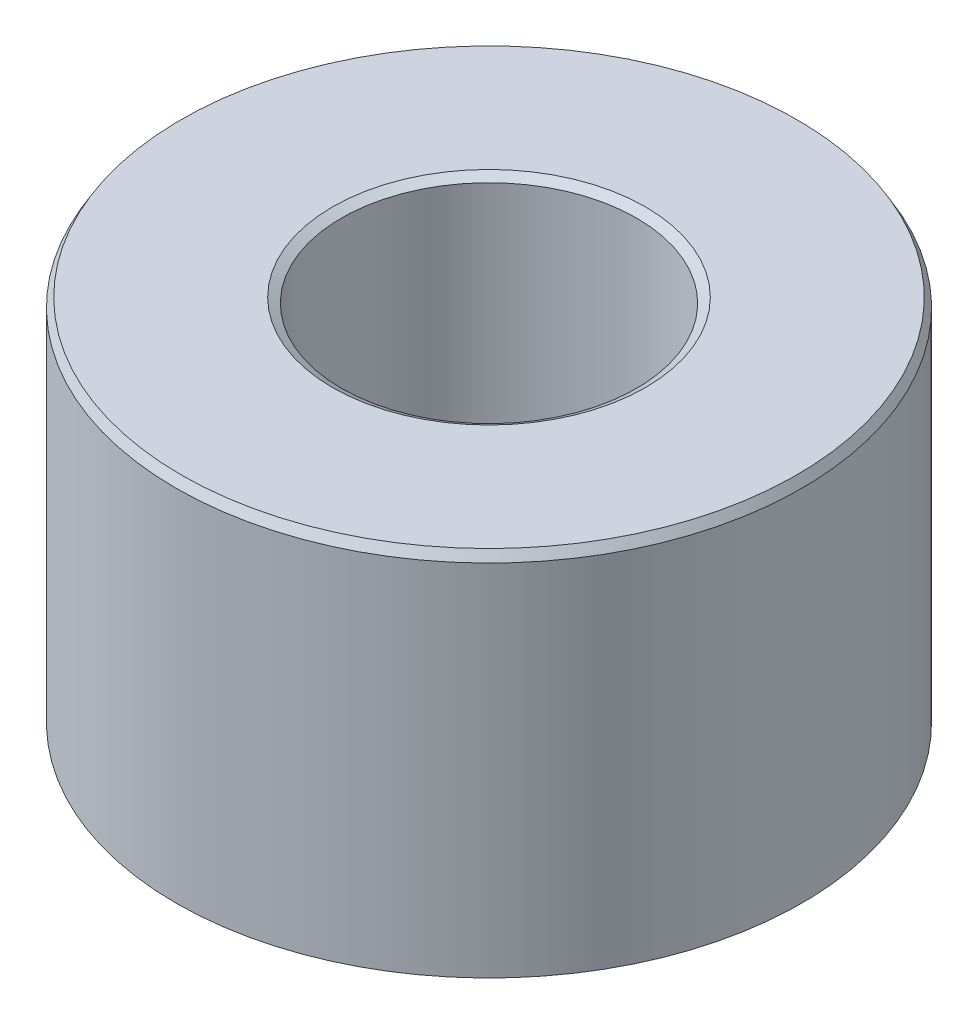
from build123d import *
from OCP.BRepFilletAPI import BRepFilletAPI_MakeChamfer

# Parameters (mm, degrees)
SKETCH1_R           = 40
BOSS_EXTRUDE1_DEPTH = 47.73325564
SKETCH2_R           = 18.860530615
CUT_EXTRUDE1_DEPTH  = 75.016644709
CHAMFER1_SIZE       = 1.14321623
CHAMFER1_SIZE2      = 0.660036198


with BuildPart() as part:
    # Sketch1 → Boss-Extrude1 (new body)
    with BuildSketch(Plane(origin=(0, 0, 0), x_dir=(1, 0, 0), z_dir=(0, 1, 0))):
        Circle(SKETCH1_R)
    extrude(amount=BOSS_EXTRUDE1_DEPTH)

    # Sketch2 → Cut-Extrude1 (cut, through all)
    with BuildSketch(Plane(origin=(0, 0, 0), x_dir=(1, 0, 0), z_dir=(0, 1, 0))):
        Circle(SKETCH2_R)
    extrude(amount=CUT_EXTRUDE1_DEPTH, mode=Mode.SUBTRACT)

    # Chamfer1: one chamfer whose edges measure the first distance from different faces: ONE call of the kernel's chamfer builder (chamfer() names one face for all edges)
    chamfer1_edges_1 = [part.edges().sort_by_distance(p)[0] for p in [
        (-18.860530615, 47.73325564, 0),
    ]]
    chamfer1_side_1 = [part.faces().sort_by_distance(p)[0] for p in [
        (-38.86862915, 47.73325564, 0),
    ]]
    chamfer1_edges_2 = [part.edges().sort_by_distance(p)[0] for p in [
        (-18.860530615, 0, 0),
    ]]
    chamfer1_side_2 = [part.faces().sort_by_distance(p)[0] for p in [
        (-18.860530615, 23.86662782, 0),
    ]]
    chamfer1_edges_3 = [part.edges().sort_by_distance(p)[0] for p in [
        (-40, 0, 0),
    ]]
    chamfer1_side_3 = [part.faces().sort_by_distance(p)[0] for p in [
        (-38.86862915, 0, 0),
    ]]
    chamfer1_edges_4 = [part.edges().sort_by_distance(p)[0] for p in [
        (-40, 47.73325564, 0),
    ]]
    chamfer1_side_4 = [part.faces().sort_by_distance(p)[0] for p in [
        (-40, 23.86662782, 0),
    ]]
    chamfer1 = BRepFilletAPI_MakeChamfer(part.part.solid().wrapped)
    for e in chamfer1_edges_1:
        chamfer1.Add(CHAMFER1_SIZE, CHAMFER1_SIZE2, e.wrapped, chamfer1_side_1[0].wrapped)  # the first distance lies on this face
    for e in chamfer1_edges_2:
        chamfer1.Add(CHAMFER1_SIZE, CHAMFER1_SIZE2, e.wrapped, chamfer1_side_2[0].wrapped)  # the first distance lies on this face
    for e in chamfer1_edges_3:
        chamfer1.Add(CHAMFER1_SIZE, CHAMFER1_SIZE2, e.wrapped, chamfer1_side_3[0].wrapped)  # the first distance lies on this face
    for e in chamfer1_edges_4:
        chamfer1.Add(CHAMFER1_SIZE, CHAMFER1_SIZE2, e.wrapped, chamfer1_side_4[0].wrapped)  # the first distance lies on this face
    add(Compound.cast(chamfer1.Shape()), mode=Mode.REPLACE)


solid = part.part
